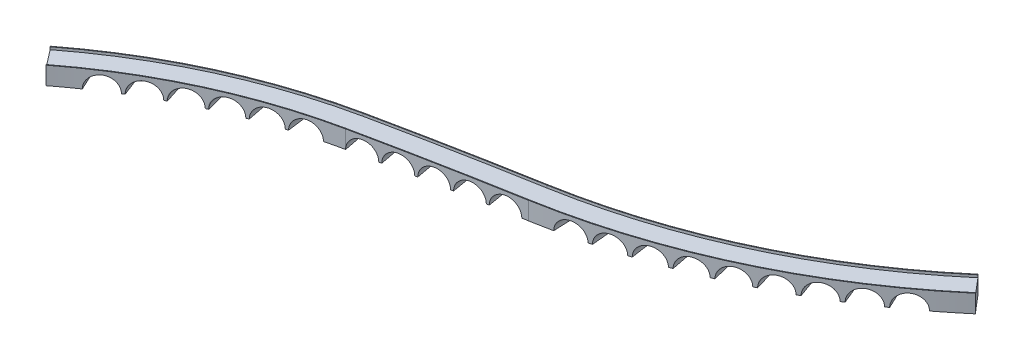
from build123d import *

# Parameters (mm, degrees)
BOSS_EXTRUDE1_DEPTH     = 6
CUT_EXTRUDE1_REACH      = 285.084
CUT_EXTRUDE1_END_RADIUS = 208.764310120788
CUT_EXTRUDE2_REACH      = 281.337
CUT_EXTRUDE2_END_RADIUS = 1833.2409365751573
CUT_EXTRUDE3_REACH      = 284.941
CUT_EXTRUDE3_END_RADIUS = 251.74927108756617
BOSS_EXTRUDE2_DEPTH     = 1


with BuildPart() as part:
    # Sketch2 → Boss-Extrude1 (new body)
    with BuildSketch(Plane(origin=(0, 0, 0), x_dir=(1, 0, 0), z_dir=(0, 1, 0))):
        with BuildLine():
            Line((0, 0), (-5.611376404797613, 7.290573012025902))
            ThreePointArc((-5.611376404797613, 7.290573012025902), (34.31534904282486, 31.44052000393745), (78.60880540146674, 46.11883967912655))
            ThreePointArc((78.60880540146674, 46.11883967912655), (108.78324685089069, 52.223250913342554), (139.05594172533148, 57.82009809189881))
            ThreePointArc((139.05594172533148, 57.82009809189881), (200.13893457791548, 77.17793880992573), (254.02121543957435, 111.8558542928184))
            Line((254.02121543957435, 111.8558542928184), (259.97843965895805, 104.84504267076063))
            ThreePointArc((259.97843965895805, 104.84504267076063), (204.05238030353405, 68.85177867738918), (140.65248280009703, 48.759686589290915))
            ThreePointArc((140.65248280009703, 48.759686589290915), (110.53170946923967, 43.19092682304108), (80.50869648499784, 37.11715017822056))
            ThreePointArc((80.50869648499784, 37.11715017822056), (38.167201159655804, 23.085686955332307), (0, 0))
        make_face()
    extrude(amount=BOSS_EXTRUDE1_DEPTH)

    # Cut-Extrude1: up to this cylinder (the profile starts inside it)
    cut_extrude1_end = Plane(origin=(121.72070228820634, 2.334272, 158.14545364458598), z_dir=(0, -1, 0)) * Cylinder(CUT_EXTRUDE1_END_RADIUS, 988.696620241576, mode=Mode.PRIVATE)
    # Sketch3<2> → Cut-Extrude1 (cut, up to the surface)
    with BuildSketch(Plane(origin=(0, 0, 0), x_dir=(0.9081340270222985, 0, -0.4186795779164102), z_dir=(0.4186795779164102, 0, 0.9081340270222985)), mode=Mode.PRIVATE) as cut_extrude1_sk1:
        with BuildLine():
            Line((10, 0), (21, 0))
            ThreePointArc((21, 0), (15.499999999999998, 5.500000000000001), (10, 0))
        make_face()
    cut_extrude1_tool1 = extrude(cut_extrude1_sk1.sketch, amount=-CUT_EXTRUDE1_REACH, mode=Mode.PRIVATE) & cut_extrude1_end
    add(cut_extrude1_tool1.solids().sort_by_distance((14.076077, 2.334272, -6.489533))[0], mode=Mode.SUBTRACT)

    # CrvPattern10: read off the stored shape, not the designer's step
    # CrvPattern10: loft between two sections, ruled curve by curve
    crvpattern10_from = [
        Edge.make_three_point_arc((24.760166559, 0, -26.736107608), (23.259354608, 3.889087297, -26.150784427), (19.636074042, 5.5, -24.737689265)),
        Edge.make_three_point_arc((19.636074042, 5.5, -24.737689265), (16.012793476, 3.889087297, -23.324594102), (14.511981525, 0, -22.739270921)),
        Edge.make_line((14.511981525, 0, -22.739270921), (24.760166559, 0, -26.736107608)),
    ]
    crvpattern10_to = [
        Edge.make_three_point_arc((28.704878717, 0, -16.621573725), (27.204066766, 3.889087297, -16.036250544), (23.5807862, 5.5, -14.623155382)),
        Edge.make_three_point_arc((23.5807862, 5.5, -14.623155382), (19.957505633, 3.889087297, -13.210060219), (18.456693683, 0, -12.624737038)),
        Edge.make_line((18.456693683, 0, -12.624737038), (28.704878717, 0, -16.621573725)),
    ]
    crvpattern10 = Solid(Shell([*[Face.make_surface_from_curves(crvpattern10_from[k], crvpattern10_to[k]) for k in range(3)], Face(Wire(crvpattern10_from)), Face(Wire(crvpattern10_to))]))
    add(crvpattern10, mode=Mode.SUBTRACT)

    # CrvPattern10 2: loft between two sections, ruled curve by curve
    crvpattern10_2_from = [
        Edge.make_three_point_arc((59.977746595, 0, -41.2795814), (58.396271472, 3.889087297, -40.973026063), (54.578252783, 5.5, -40.23293601)),
        Edge.make_three_point_arc((54.578252783, 5.5, -40.23293601), (50.760234093, 3.889087297, -39.492845958), (49.17875897, 0, -39.186290621)),
        Edge.make_line((49.17875897, 0, -39.186290621), (59.977746595, 0, -41.2795814)),
    ]
    crvpattern10_2_to = [
        Edge.make_three_point_arc((62.037921137, 0, -30.651435706), (60.456446014, 3.889087297, -30.344880369), (56.638427324, 5.5, -29.604790316)),
        Edge.make_three_point_arc((56.638427324, 5.5, -29.604790316), (52.820408635, 3.889087297, -28.864700264), (51.238933512, 0, -28.558144927)),
        Edge.make_line((51.238933512, 0, -28.558144927), (62.037921137, 0, -30.651435706)),
    ]
    crvpattern10_2 = Solid(Shell([*[Face.make_surface_from_curves(crvpattern10_2_from[k], crvpattern10_2_to[k]) for k in range(3)], Face(Wire(crvpattern10_2_from)), Face(Wire(crvpattern10_2_to))]))
    add(crvpattern10_2, mode=Mode.SUBTRACT)

    # CrvPattern10 3: loft between two sections, ruled curve by curve
    crvpattern10_3_from = [
        Edge.make_three_point_arc((72.227384268, 0, -44.667141259), (70.630345013, 3.889087297, -44.456178339), (66.774751182, 5.5, -43.946868795)),
        Edge.make_three_point_arc((66.774751182, 5.5, -43.946868795), (62.919157351, 3.889087297, -43.437559251), (61.322118095, 0, -43.226596331)),
        Edge.make_line((61.322118095, 0, -43.226596331), (72.227384268, 0, -44.667141259)),
    ]
    crvpattern10_3_to = [
        Edge.make_three_point_arc((73.643864767, 0, -33.944048518), (72.046825511, 3.889087297, -33.733085598), (68.19123168, 5.5, -33.223776054)),
        Edge.make_three_point_arc((68.19123168, 5.5, -33.223776054), (64.335637849, 3.889087297, -32.71446651), (62.738598593, 0, -32.50350359)),
        Edge.make_line((62.738598593, 0, -32.50350359), (73.643864767, 0, -33.944048518)),
    ]
    crvpattern10_3 = Solid(Shell([*[Face.make_surface_from_curves(crvpattern10_3_from[k], crvpattern10_3_to[k]) for k in range(3)], Face(Wire(crvpattern10_3_from)), Face(Wire(crvpattern10_3_to))]))
    add(crvpattern10_3, mode=Mode.SUBTRACT)

    # CrvPattern10 4: loft between two sections, ruled curve by curve
    crvpattern10_4_from = [
        Edge.make_three_point_arc((36.199268749, 0, -32.297770403), (34.665994393, 3.889087297, -31.803696028), (30.964342649, 5.5, -30.610894971)),
        Edge.make_three_point_arc((30.964342649, 5.5, -30.610894971), (27.262690904, 3.889087297, -29.418093914), (25.729416548, 0, -28.924019539)),
        Edge.make_line((25.729416548, 0, -28.924019539), (36.199268749, 0, -32.297770403)),
    ]
    crvpattern10_4_to = [
        Edge.make_three_point_arc((39.525837356, 0, -21.974340176), (37.992563, 3.889087297, -21.480265801), (34.290911255, 5.5, -20.287464744)),
        Edge.make_three_point_arc((34.290911255, 5.5, -20.287464744), (30.589259511, 3.889087297, -19.094663687), (29.055985155, 0, -18.600589312)),
        Edge.make_line((29.055985155, 0, -18.600589312), (39.525837356, 0, -21.974340176)),
    ]
    crvpattern10_4 = Solid(Shell([*[Face.make_surface_from_curves(crvpattern10_4_from[k], crvpattern10_4_to[k]) for k in range(3)], Face(Wire(crvpattern10_4_from)), Face(Wire(crvpattern10_4_to))]))
    add(crvpattern10_4, mode=Mode.SUBTRACT)

    # CrvPattern10 5: loft between two sections, ruled curve by curve
    crvpattern10_5_from = [
        Edge.make_three_point_arc((47.953254337, 0, -37.151501792), (46.393059821, 3.889087297, -36.750462128), (42.626417062, 5.5, -35.782266731)),
        Edge.make_three_point_arc((42.626417062, 5.5, -35.782266731), (38.859774303, 3.889087297, -34.814071334), (37.299579788, 0, -34.413031669)),
        Edge.make_line((37.299579788, 0, -34.413031669), (47.953254337, 0, -37.151501792)),
    ]
    crvpattern10_5_to = [
        Edge.make_three_point_arc((50.65088715, 0, -26.656699673), (49.090692635, 3.889087297, -26.255660009), (45.324049876, 5.5, -25.287464612)),
        Edge.make_three_point_arc((45.324049876, 5.5, -25.287464612), (41.557407117, 3.889087297, -24.319269215), (39.997212602, 0, -23.91822955)),
        Edge.make_line((39.997212602, 0, -23.91822955), (50.65088715, 0, -26.656699673)),
    ]
    crvpattern10_5 = Solid(Shell([*[Face.make_surface_from_curves(crvpattern10_5_from[k], crvpattern10_5_to[k]) for k in range(3)], Face(Wire(crvpattern10_5_from)), Face(Wire(crvpattern10_5_to))]))
    add(crvpattern10_5, mode=Mode.SUBTRACT)

    # Cut-Extrude2: up to this cylinder (the profile starts inside it)
    cut_extrude2_end = Plane(origin=(457.1912085931325, 2.334272, 1747.6056919947262), z_dir=(0, -1, 0)) * Cylinder(CUT_EXTRUDE2_END_RADIUS, 4230.155873150315, mode=Mode.PRIVATE)
    # Sketch5 → Cut-Extrude2 (cut, up to the surface)
    with BuildSketch(Plane(origin=(-4.0176564775836825, 0, -20.754676141318196), x_dir=(0.9817743576414402, 0, -0.1900502846031481), z_dir=(0.1900502846031481, 0, 0.9817743576414402)), mode=Mode.PRIVATE) as cut_extrude2_sk1:
        with BuildLine():
            Line((86.09549873113613, 0), (97.09549873113613, 0))
            ThreePointArc((97.09549873113613, 0), (91.59549873113612, 5.499999999999986), (86.09549873113613, 0))
        make_face()
    cut_extrude2_tool1 = extrude(cut_extrude2_sk1.sketch, amount=-CUT_EXTRUDE2_REACH, mode=Mode.PRIVATE) & cut_extrude2_end
    add(cut_extrude2_tool1.solids().sort_by_distance((85.908455, 2.334272, -38.162427))[0], mode=Mode.SUBTRACT)

    # CrvPattern11: read off the stored shape, not the designer's step
    # CrvPattern11: loft between two sections, ruled curve by curve
    crvpattern11_from = [
        Edge.make_three_point_arc((101.354751447, 0, -50.769337664), (99.771218774, 3.889087297, -50.473594516), (95.948232717, 5.5, -49.759607395)),
        Edge.make_three_point_arc((95.948232717, 5.5, -49.759607395), (92.12524666, 3.889087297, -49.045620275), (90.541713986, 0, -48.749877127)),
        Edge.make_line((90.541713986, 0, -48.749877127), (101.354751447, 0, -50.769337664)),
    ]
    crvpattern11_to = [
        Edge.make_three_point_arc((103.071676757, 0, -41.576200517), (101.488144083, 3.889087297, -41.280457368), (97.665158026, 5.5, -40.566470248)),
        Edge.make_three_point_arc((97.665158026, 5.5, -40.566470248), (93.842171969, 3.889087297, -39.852483128), (92.258639295, 0, -39.556739979)),
        Edge.make_line((92.258639295, 0, -39.556739979), (103.071676757, 0, -41.576200517)),
    ]
    crvpattern11 = Solid(Shell([*[Face.make_surface_from_curves(crvpattern11_from[k], crvpattern11_to[k]) for k in range(3)], Face(Wire(crvpattern11_from)), Face(Wire(crvpattern11_to))]))
    add(crvpattern11, mode=Mode.SUBTRACT)

    # CrvPattern11 2: loft between two sections, ruled curve by curve
    crvpattern11_2_from = [
        Edge.make_three_point_arc((136.916829083, 0, -57.441856787), (135.327768287, 3.889087297, -57.177422441), (131.491436161, 5.5, -56.539021455)),
        Edge.make_three_point_arc((131.491436161, 5.5, -56.539021455), (127.655104035, 3.889087297, -55.900620468), (126.066043239, 0, -55.636186122)),
        Edge.make_line((126.066043239, 0, -55.636186122), (136.916829083, 0, -57.441856787)),
    ]
    crvpattern11_2_to = [
        Edge.make_three_point_arc((138.451987028, 0, -48.216658408), (136.862926232, 3.889087297, -47.952224062), (133.026594106, 5.5, -47.313823075)),
        Edge.make_three_point_arc((133.026594106, 5.5, -47.313823075), (129.19026198, 3.889087297, -46.675422089), (127.601201184, 0, -46.410987743)),
        Edge.make_line((127.601201184, 0, -46.410987743), (138.451987028, 0, -48.216658408)),
    ]
    crvpattern11_2 = Solid(Shell([*[Face.make_surface_from_curves(crvpattern11_2_from[k], crvpattern11_2_to[k]) for k in range(3)], Face(Wire(crvpattern11_2_from)), Face(Wire(crvpattern11_2_to))]))
    add(crvpattern11_2, mode=Mode.SUBTRACT)

    # CrvPattern11 3: loft between two sections, ruled curve by curve
    crvpattern11_3_from = [
        Edge.make_three_point_arc((113.194058748, 0, -53.071484079), (111.608614721, 3.889087297, -52.786165), (107.78101425, 5.5, -52.097343808)),
        Edge.make_three_point_arc((107.78101425, 5.5, -52.097343808), (103.953413779, 3.889087297, -51.408522617), (102.367969753, 0, -51.123203538)),
        Edge.make_line((102.367969753, 0, -51.123203538), (113.194058748, 0, -53.071484079)),
    ]
    crvpattern11_3_to = [
        Edge.make_three_point_arc((114.850466241, 0, -43.867257815), (113.265022214, 3.889087297, -43.581938735), (109.437421743, 5.5, -42.893117544)),
        Edge.make_three_point_arc((109.437421743, 5.5, -42.893117544), (105.609821272, 3.889087297, -42.204296353), (104.024377245, 0, -41.918977274)),
        Edge.make_line((104.024377245, 0, -41.918977274), (114.850466241, 0, -43.867257815)),
    ]
    crvpattern11_3 = Solid(Shell([*[Face.make_surface_from_curves(crvpattern11_3_from[k], crvpattern11_3_to[k]) for k in range(3)], Face(Wire(crvpattern11_3_from)), Face(Wire(crvpattern11_3_to))]))
    add(crvpattern11_3, mode=Mode.SUBTRACT)

    # CrvPattern11 4: loft between two sections, ruled curve by curve
    crvpattern11_4_from = [
        Edge.make_three_point_arc((125.048255669, 0, -55.295689212), (123.460968908, 3.889087297, -55.02080655), (119.628919683, 5.5, -54.357181101)),
        Edge.make_three_point_arc((119.628919683, 5.5, -54.357181101), (115.796870458, 3.889087297, -53.693555651), (114.209583697, 0, -53.418672989)),
        Edge.make_line((114.209583697, 0, -53.418672989), (125.048255669, 0, -55.295689212)),
    ]
    crvpattern11_4_to = [
        Edge.make_three_point_arc((126.64407315, 0, -46.080775671), (125.056786389, 3.889087297, -45.80589301), (121.224737164, 5.5, -45.14226756)),
        Edge.make_three_point_arc((121.224737164, 5.5, -45.14226756), (117.392687939, 3.889087297, -44.47864211), (115.805401179, 0, -44.203759449)),
        Edge.make_line((115.805401179, 0, -44.203759449), (126.64407315, 0, -46.080775671)),
    ]
    crvpattern11_4 = Solid(Shell([*[Face.make_surface_from_curves(crvpattern11_4_from[k], crvpattern11_4_to[k]) for k in range(3)], Face(Wire(crvpattern11_4_from)), Face(Wire(crvpattern11_4_to))]))
    add(crvpattern11_4, mode=Mode.SUBTRACT)

    # Cut-Extrude3: up to this cylinder (the profile starts inside it)
    cut_extrude3_end = Plane(origin=(96.9646510790562, 2.334272, -296.6892508865625), z_dir=(0, -1, 0)) * Cylinder(CUT_EXTRUDE3_END_RADIUS, 1074.3805421751322, mode=Mode.PRIVATE)
    # Sketch7 → Cut-Extrude3 (cut, up to the surface)
    with BuildSketch(Plane(origin=(2.9021864367984436, 0, 6.174627349262755), x_dir=(-0.9050174057104791, 0, 0.4253745353933098), z_dir=(-0.42537453539330977, 0, -0.905017405710479)), mode=Mode.PRIVATE) as cut_extrude3_sk1:
        with BuildLine():
            Line((-267.4742534433755, 0), (-256.47425344337546, 0))
            ThreePointArc((-256.47425344337546, 0), (-261.9742534433755, 5.499999999999997), (-267.4742534433755, 0))
        make_face()
    cut_extrude3_tool1 = extrude(cut_extrude3_sk1.sketch, amount=-CUT_EXTRUDE3_REACH, mode=Mode.PRIVATE) & cut_extrude3_end
    add(cut_extrude3_tool1.solids().sort_by_distance((239.993446, 2.334272, -105.262549))[0], mode=Mode.SUBTRACT)

    # CrvPattern12: read off the stored shape, not the designer's step
    # CrvPattern12: loft between two sections, ruled curve by curve
    crvpattern12_from = [
        Edge.make_three_point_arc((230.455134918, 0, -83.246082266), (231.945143172, 3.889087297, -83.858385411), (235.542341306, 5.5, -85.336615968)),
        Edge.make_three_point_arc((235.542341306, 5.5, -85.336615968), (239.139539441, 3.889087297, -86.814846525), (240.629547695, 0, -87.42714967)),
        Edge.make_line((240.629547695, 0, -87.42714967), (230.455134918, 0, -83.246082266)),
    ]
    crvpattern12_to = [
        Edge.make_three_point_arc((226.064274103, 0, -93.931016533), (227.554282357, 3.889087297, -94.543319678), (231.151480492, 5.5, -96.021550235)),
        Edge.make_three_point_arc((231.151480492, 5.5, -96.021550235), (234.748678627, 3.889087297, -97.499780792), (236.23868688, 0, -98.112083937)),
        Edge.make_line((236.23868688, 0, -98.112083937), (226.064274103, 0, -93.931016533)),
    ]
    crvpattern12 = Solid(Shell([*[Face.make_surface_from_curves(crvpattern12_from[k], crvpattern12_to[k]) for k in range(3)], Face(Wire(crvpattern12_from)), Face(Wire(crvpattern12_to))]))
    add(crvpattern12, mode=Mode.SUBTRACT)

    # CrvPattern12 2: loft between two sections, ruled curve by curve
    crvpattern12_2_from = [
        Edge.make_three_point_arc((161.22484187, 0, -53.279465987), (162.828785075, 3.889087297, -53.429152101), (166.701046514, 5.5, -53.790526346)),
        Edge.make_three_point_arc((166.701046514, 5.5, -53.790526346), (170.573307954, 3.889087297, -54.151900592), (172.177251159, 0, -54.301586705)),
        Edge.make_line((172.177251159, 0, -54.301586705), (161.22484187, 0, -53.279465987)),
    ]
    crvpattern12_2_to = [
        Edge.make_three_point_arc((160.156402682, 0, -64.728195168), (161.760345887, 3.889087297, -64.877881282), (165.632607326, 5.5, -65.239255527)),
        Edge.make_three_point_arc((165.632607326, 5.5, -65.239255527), (169.504868765, 3.889087297, -65.600629773), (171.108811971, 0, -65.750315886)),
        Edge.make_line((171.108811971, 0, -65.750315886), (160.156402682, 0, -64.728195168)),
    ]
    crvpattern12_2 = Solid(Shell([*[Face.make_surface_from_curves(crvpattern12_2_from[k], crvpattern12_2_to[k]) for k in range(3)], Face(Wire(crvpattern12_2_from)), Face(Wire(crvpattern12_2_to))]))
    add(crvpattern12_2, mode=Mode.SUBTRACT)

    # CrvPattern12 3: loft between two sections, ruled curve by curve
    crvpattern12_3_from = [
        Edge.make_three_point_arc((173.332454257, 0, -56.802498141), (174.927032235, 3.889087297, -57.03132299), (178.776684015, 5.5, -57.583755043)),
        Edge.make_three_point_arc((178.776684015, 5.5, -57.583755043), (182.626335794, 3.889087297, -58.136187097), (184.220913772, 0, -58.365011946)),
        Edge.make_line((184.220913772, 0, -58.365011946), (173.332454257, 0, -56.802498141)),
    ]
    crvpattern12_3_to = [
        Edge.make_three_point_arc((171.697941724, 0, -68.192684565), (173.292519702, 3.889087297, -68.421509414), (177.142171482, 5.5, -68.973941468)),
        Edge.make_three_point_arc((177.142171482, 5.5, -68.973941468), (180.991823262, 3.889087297, -69.526373522), (182.586401239, 0, -69.755198371)),
        Edge.make_line((182.586401239, 0, -69.755198371), (171.697941724, 0, -68.192684565)),
    ]
    crvpattern12_3 = Solid(Shell([*[Face.make_surface_from_curves(crvpattern12_3_from[k], crvpattern12_3_to[k]) for k in range(3)], Face(Wire(crvpattern12_3_from)), Face(Wire(crvpattern12_3_to))]))
    add(crvpattern12_3, mode=Mode.SUBTRACT)

    # CrvPattern12 4: loft between two sections, ruled curve by curve
    crvpattern12_4_from = [
        Edge.make_three_point_arc((148.960569813, 0, -50.368078553), (150.569953036, 3.889087297, -50.438259615), (154.455347838, 5.5, -50.607691688)),
        Edge.make_three_point_arc((154.455347838, 5.5, -50.607691688), (158.340742641, 3.889087297, -50.77712376), (159.950125863, 0, -50.847304823)),
        Edge.make_line((159.950125863, 0, -50.847304823), (148.960569813, 0, -50.368078553)),
    ]
    crvpattern12_4_to = [
        Edge.make_three_point_arc((148.459981247, 0, -61.847512065), (150.069364469, 3.889087297, -61.917693127), (153.954759272, 5.5, -62.0871252)),
        Edge.make_three_point_arc((153.954759272, 5.5, -62.0871252), (157.840154075, 3.889087297, -62.256557273), (159.449537297, 0, -62.326738335)),
        Edge.make_line((159.449537297, 0, -62.326738335), (148.459981247, 0, -61.847512065)),
    ]
    crvpattern12_4 = Solid(Shell([*[Face.make_surface_from_curves(crvpattern12_4_from[k], crvpattern12_4_to[k]) for k in range(3)], Face(Wire(crvpattern12_4_from)), Face(Wire(crvpattern12_4_to))]))
    add(crvpattern12_4, mode=Mode.SUBTRACT)

    # CrvPattern12 5: loft between two sections, ruled curve by curve
    crvpattern12_5_from = [
        Edge.make_three_point_arc((208.408307552, 0, -70.950448423), (209.951515442, 3.889087297, -71.412562204), (213.677148859, 5.5, -72.528203561)),
        Edge.make_three_point_arc((213.677148859, 5.5, -72.528203561), (217.402782276, 3.889087297, -73.643844919), (218.945990166, 0, -74.1059587)),
        Edge.make_line((218.945990166, 0, -74.1059587), (208.408307552, 0, -70.950448423)),
    ]
    crvpattern12_5_to = [
        Edge.make_three_point_arc((205.099791266, 0, -81.999087622), (206.642999156, 3.889087297, -82.461201403), (210.368632573, 5.5, -83.576842761)),
        Edge.make_three_point_arc((210.368632573, 5.5, -83.576842761), (214.094265991, 3.889087297, -84.692484118), (215.637473881, 0, -85.154597899)),
        Edge.make_line((215.637473881, 0, -85.154597899), (205.099791266, 0, -81.999087622)),
    ]
    crvpattern12_5 = Solid(Shell([*[Face.make_surface_from_curves(crvpattern12_5_from[k], crvpattern12_5_to[k]) for k in range(3)], Face(Wire(crvpattern12_5_from)), Face(Wire(crvpattern12_5_to))]))
    add(crvpattern12_5, mode=Mode.SUBTRACT)

    # CrvPattern12 6: loft between two sections, ruled curve by curve
    crvpattern12_6_from = [
        Edge.make_three_point_arc((219.5847701, 0, -76.821104223), (221.103236186, 3.889087297, -77.358970826), (224.769137606, 5.5, -78.657495675)),
        Edge.make_three_point_arc((224.769137606, 5.5, -78.657495675), (228.435039025, 3.889087297, -79.956020524), (229.953505112, 0, -80.493887127)),
        Edge.make_line((229.953505112, 0, -80.493887127), (219.5847701, 0, -76.821104223)),
    ]
    crvpattern12_6_to = [
        Edge.make_three_point_arc((215.730823937, 0, -87.701286241), (217.249290024, 3.889087297, -88.239152844), (220.915191443, 5.5, -89.537677693)),
        Edge.make_three_point_arc((220.915191443, 5.5, -89.537677693), (224.581092863, 3.889087297, -90.836202542), (226.099558949, 0, -91.374069145)),
        Edge.make_line((226.099558949, 0, -91.374069145), (215.730823937, 0, -87.701286241)),
    ]
    crvpattern12_6 = Solid(Shell([*[Face.make_surface_from_curves(crvpattern12_6_from[k], crvpattern12_6_to[k]) for k in range(3)], Face(Wire(crvpattern12_6_from)), Face(Wire(crvpattern12_6_to))]))
    add(crvpattern12_6, mode=Mode.SUBTRACT)

    # CrvPattern12 7: loft between two sections, ruled curve by curve
    crvpattern12_7_from = [
        Edge.make_three_point_arc((185.252479132, 0, -60.92887482), (186.833789591, 3.889087297, -61.236278418), (190.651410746, 5.5, -61.978416355)),
        Edge.make_three_point_arc((190.651410746, 5.5, -61.978416355), (194.469031901, 3.889087297, -62.720554292), (196.050342359, 0, -63.02795789)),
        Edge.make_line((196.050342359, 0, -63.02795789), (185.252479132, 0, -60.92887482)),
    ]
    crvpattern12_7_to = [
        Edge.make_three_point_arc((183.05502669, 0, -72.232758529), (184.636337148, 3.889087297, -72.540162127), (188.453958303, 5.5, -73.282300064)),
        Edge.make_three_point_arc((188.453958303, 5.5, -73.282300064), (192.271579458, 3.889087297, -74.024438001), (193.852889916, 0, -74.331841599)),
        Edge.make_line((193.852889916, 0, -74.331841599), (183.05502669, 0, -72.232758529)),
    ]
    crvpattern12_7 = Solid(Shell([*[Face.make_surface_from_curves(crvpattern12_7_from[k], crvpattern12_7_to[k]) for k in range(3)], Face(Wire(crvpattern12_7_from)), Face(Wire(crvpattern12_7_to))]))
    add(crvpattern12_7, mode=Mode.SUBTRACT)

    # CrvPattern12 8: loft between two sections, ruled curve by curve
    crvpattern12_8_from = [
        Edge.make_three_point_arc((196.954421619, 0, -65.648688878), (198.518594735, 3.889087297, -66.033918941), (202.294842686, 5.5, -66.963946581)),
        Edge.make_three_point_arc((202.294842686, 5.5, -66.963946581), (206.071090637, 3.889087297, -67.893974222), (207.635263753, 0, -68.279204284)),
        Edge.make_line((207.635263753, 0, -68.279204284), (196.954421619, 0, -65.648688878)),
    ]
    crvpattern12_8_to = [
        Edge.make_three_point_arc((194.198517683, 0, -76.838653707), (195.762690799, 3.889087297, -77.223883769), (199.53893875, 5.5, -78.15391141)),
        Edge.make_three_point_arc((199.53893875, 5.5, -78.15391141), (203.315186701, 3.889087297, -79.08393905), (204.879359818, 0, -79.469169113)),
        Edge.make_line((204.879359818, 0, -79.469169113), (194.198517683, 0, -76.838653707)),
    ]
    crvpattern12_8 = Solid(Shell([*[Face.make_surface_from_curves(crvpattern12_8_from[k], crvpattern12_8_to[k]) for k in range(3)], Face(Wire(crvpattern12_8_from)), Face(Wire(crvpattern12_8_to))]))
    add(crvpattern12_8, mode=Mode.SUBTRACT)

    # Sketch8 → Boss-Extrude2 (add)
    with BuildSketch(Plane(origin=(0, 6, 0), x_dir=(1, 0, 0), z_dir=(0, 1, 0))):
        with BuildLine():
            ThreePointArc((139.10800284733514, 57.524649890726465), (200.2665469385338, 76.90643358821231), (254.2154727510759, 111.62724087036011))
            Line((254.21547275107588, 111.6272408703601), (254.02121543957418, 111.85585429281858))
            ThreePointArc((254.0212154395742, 111.85585429281855), (200.1389345779158, 77.17793880992554), (139.05594172533193, 57.82009809189856))
            ThreePointArc((139.05594172533193, 57.820098091898444), (108.78324685089058, 52.223250913342326), (78.60880540146661, 46.118839679126495))
            ThreePointArc((78.60880540146661, 46.11883967912655), (34.315349042824764, 31.440520003937394), (-5.611376404797639, 7.290573012025902))
            Line((-5.611376404797613, 7.290573012025902), (-5.428396739423805, 7.052836935546831))
            ThreePointArc((-5.4283967394238175, 7.0528369355468215), (34.44095291619968, 31.168079795830806), (78.67075837158177, 45.82530632583618))
            ThreePointArc((78.67075837158177, 45.82530632583621), (108.84026193627147, 51.92871860605055), (139.10800284733506, 57.52464989072678))
        make_face()
        with BuildLine():
            ThreePointArc((140.65248280009692, 48.759686589290965), (204.052380303534, 68.8517786773892), (259.97843965895805, 104.84504267076059))
            Line((259.97843965895805, 104.84504267076063), (259.7841823474564, 105.07365609321904))
            ThreePointArc((259.78418234745646, 105.07365609321909), (203.92476794291602, 69.12328389910238), (140.60042167809368, 49.05513479046297))
            ThreePointArc((140.60042167809365, 49.055134790462944), (110.47469438385792, 43.48545913033354), (80.44674351488175, 37.41068353151081))
            ThreePointArc((80.4467435148818, 37.41068353151101), (38.04159728628042, 23.358127163438922), (-0.182979665373864, 0.23773607647919448))
            Line((-0.1829796653739093, 0.23773607647915895), (-5.596e-14, 2.753e-14))
            ThreePointArc((-5.684e-14, 5.684e-14), (38.16720115965532, 23.08568695533222), (80.5086964849969, 37.117150178220584))
            ThreePointArc((80.50869648499685, 37.117150178220754), (110.53170946923888, 43.19092682304108), (140.6524828000969, 48.75968658929105))
        make_face()
    extrude(amount=BOSS_EXTRUDE2_DEPTH)


solid = part.part
